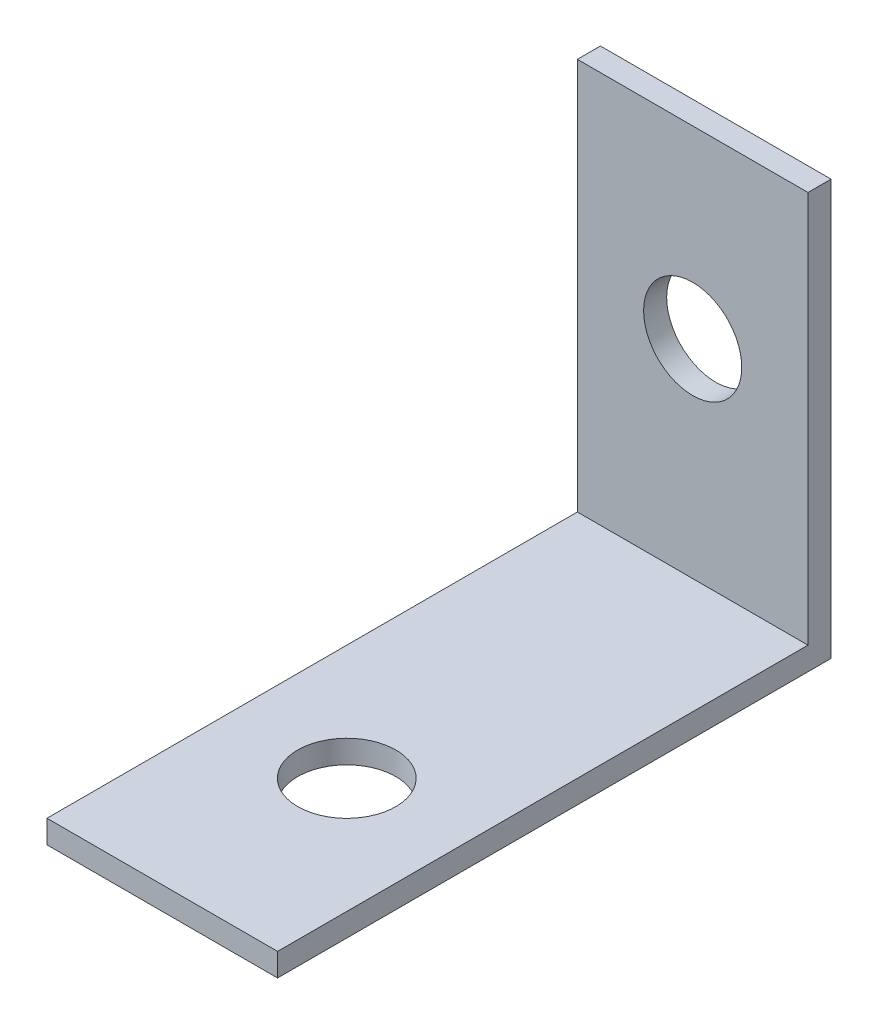
from build123d import *

# Parameters (mm, degrees)
BASE_FLANGE1_DEPTH      = 15.875
F_1_4_CLEARANCE_HOLE1_D = 6.7564
F_1_4_CLEARANCE_HOLE2_D = 6.7564
BOSS_EXTRUDE1_DEPTH     = 15.875
CUT_EXTRUDE1_DEPTH      = 49.098892269
BOSS_EXTRUDE2_DEPTH     = 1.5875
BOSS_EXTRUDE3_DEPTH     = 1.5875


# Read off the part's stored shape, not the designer's step: Base-Flange1
with BuildPart() as part:
    # Base-Flange1 outline → Base-Flange1 (new body)
    with BuildSketch(Plane(origin=(0, 0, 0), x_dir=(0, 0, -1), z_dir=(1, 0, 0))):
        with BuildLine():
            Line((1.5875, 0.79375), (1.5875, 26.9875))
            Line((1.5875, 26.9875), (0, 26.9875))
            Line((0, 26.9875), (0, 0.79375))
            ThreePointArc((0, 0.79375), (-0.232483992, 0.232483992), (-0.79375, 0))
            Line((-0.79375, 0), (-36.5125, 0))
            Line((-36.5125, 0), (-36.5125, -1.5875))
            Line((-36.5125, -1.5875), (-0.79375, -1.5875))
            ThreePointArc((-0.79375, -1.5875), (0.890048023, -0.890048023), (1.5875, 0.79375))
        make_face()
    extrude(amount=BASE_FLANGE1_DEPTH)

    # 1/4 Clearance Hole1 (through all)
    with Locations(Plane(origin=(0, 0, -1.5875), x_dir=(-1, 0, 0), z_dir=(0, 0, -1))):
        with Locations((-7.9375, 14.2875)):
            Hole(F_1_4_CLEARANCE_HOLE1_D / 2)

    # 1/4 Clearance Hole2 (through all)
    with Locations(Plane(origin=(0, 0, 0), x_dir=(1, 0, 0), z_dir=(0, 1, 0))):
        with Locations((7.9375, -23.8125)):
            Hole(F_1_4_CLEARANCE_HOLE2_D / 2)

    # Sketch11 → Boss-Extrude1 (add, through all)
    with BuildSketch(Plane(origin=(15.875, 0, 0), x_dir=(0, 0, -1), z_dir=(1, 0, 0))):
        with BuildLine():
            Line((1.5875, 0.79375), (1.5875, -1.5875))
            Line((1.5875, -1.5875), (-0.79375, -1.5875))
            ThreePointArc((-0.79375, -1.5875), (0.890048023, -0.890048023), (1.5875, 0.79375))
        make_face()
    extrude(amount=-BOSS_EXTRUDE1_DEPTH)

    # Sketch12 → Cut-Extrude1 (cut, through all)
    with BuildSketch(Plane(origin=(15.875, 0, 0), x_dir=(0, 0, -1), z_dir=(1, 0, 0))):
        with BuildLine():
            Line((-0.79375, 0), (0, 0))
            Line((0, 0), (0, 0.79375))
            ThreePointArc((0, 0.79375), (-0.232483992, 0.232483992), (-0.79375, 0))
        make_face()
    extrude(amount=-CUT_EXTRUDE1_DEPTH, mode=Mode.SUBTRACT)

    # Sketch13 → Boss-Extrude2 (add)
    with BuildSketch(Plane(origin=(15.875, 0, 0), x_dir=(0, 0, -1), z_dir=(1, 0, 0))):
        Polygon((0, 0), (0, 26.9875), (1.5875, 26.9875), (1.5875, -1.5875), (-36.5125, -1.5875), (-36.5125, 0), align=None)
    extrude(amount=-BOSS_EXTRUDE2_DEPTH)

    # Sketch14 → Boss-Extrude3 (add)
    with BuildSketch(Plane.ZY):
        Polygon((0, 0), (0, 26.9875), (-1.5875, 26.9875), (-1.5875, -1.5875), (36.5125, -1.5875), (36.5125, 0), align=None)
    extrude(amount=-BOSS_EXTRUDE3_DEPTH)


solid = part.part
